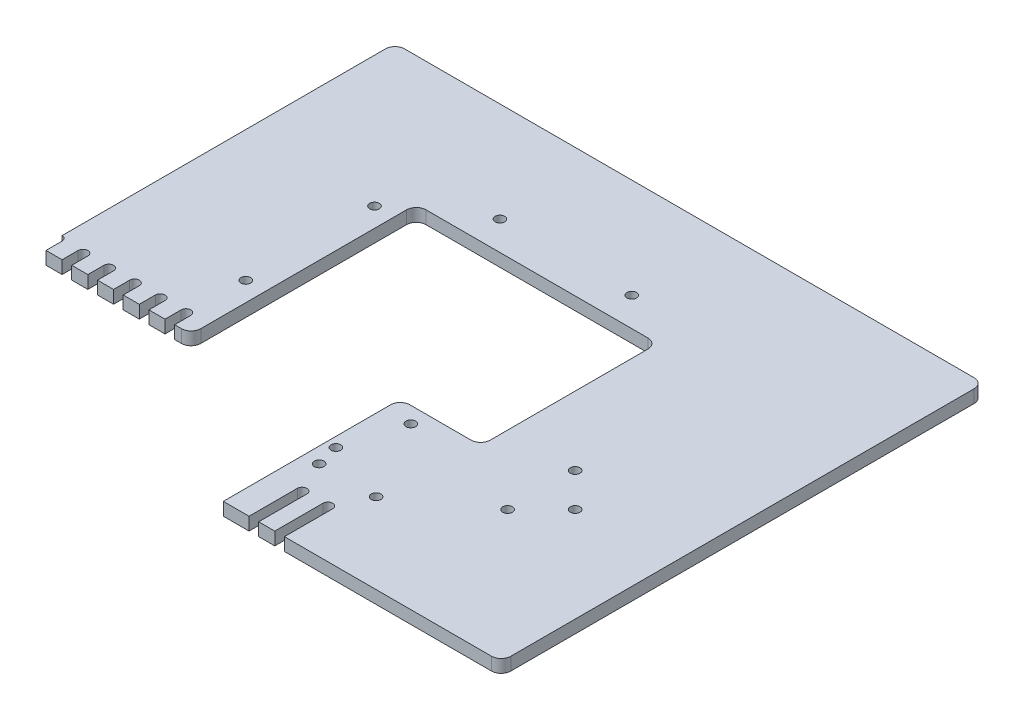
from build123d import *

# Parameters (mm, degrees)
SKETCH_1_R      = 1.5
EXTRUDE_3_DEPTH = 4
SKETCH_1_8_W    = 25
SKETCH_1_8_H    = 150
EXTRUDE_4_DEPTH = 4
FILLET_1_R      = 3


with BuildPart() as part:
    # 草图1 → 凸台-拉伸3 (new body)
    with BuildSketch(Plane(origin=(0, 0, 0), x_dir=(1, 0, 0), z_dir=(0, 1, 0))):
        with BuildLine():
            Line((97.132652086, -142.242252719), (105.132652086, -142.242252719))
            Line((105.132652086, -142.242252719), (105.132652086, -127.242252719))
            ThreePointArc((105.132652086, -127.242252719), (106.632652086, -125.742252719), (108.132652086, -127.242252719))
            Line((108.132652086, -127.242252719), (108.132652086, -142.242252719))
            Line((108.132652086, -142.242252719), (113.132652086, -142.242252719))
            Line((113.132652086, -142.242252719), (113.132652086, -127.242252719))
            ThreePointArc((113.132652086, -127.242252719), (114.632652086, -125.742252719), (116.132652086, -127.242252719))
            Line((116.132652086, -127.242252719), (116.132652086, -142.242252719))
            Line((116.132652086, -142.242252719), (158.517652086, -142.242252719))
            Line((158.517652086, -142.242252719), (158.517652086, 7.757747281))
            Line((158.517652086, 7.757747281), (0.517652086, 7.757747281))
            Line((0.517652086, 7.757747281), (0.517652086, -95.742252719))
            ThreePointArc((0.517652086, -95.742252719), (1.578312257, -96.181592547), (2.017652086, -97.242252719))
            Line((2.017652086, -97.242252719), (2.017652086, -102.242252719))
            Line((2.017652086, -102.242252719), (7.017652086, -102.242252719))
            Line((7.017652086, -102.242252719), (7.017652086, -97.242252719))
            ThreePointArc((7.017652086, -97.242252719), (8.517652086, -95.742252719), (10.017652086, -97.242252719))
            Line((10.017652086, -97.242252719), (10.017652086, -102.242252719))
            Line((10.017652086, -102.242252719), (15.017652086, -102.242252719))
            Line((15.017652086, -102.242252719), (15.017652086, -97.242252719))
            ThreePointArc((15.017652086, -97.242252719), (16.517652086, -95.742252719), (18.017652086, -97.242252719))
            Line((18.017652086, -97.242252719), (18.017652086, -102.242252719))
            Line((18.017652086, -102.242252719), (23.017652086, -102.242252719))
            Line((23.017652086, -102.242252719), (23.017652086, -97.242252719))
            ThreePointArc((23.017652086, -97.242252719), (24.517652086, -95.742252719), (26.017652086, -97.242252719))
            Line((26.017652086, -97.242252719), (26.017652086, -102.242252719))
            Line((26.017652086, -102.242252719), (31.017652086, -102.242252719))
            Line((31.017652086, -102.242252719), (31.017652086, -97.242252719))
            ThreePointArc((31.017652086, -97.242252719), (32.517652086, -95.742252719), (34.017652086, -97.242252719))
            Line((34.017652086, -97.242252719), (34.017652086, -102.242252719))
            Line((34.017652086, -102.242252719), (39.017652086, -102.242252719))
            Line((39.017652086, -102.242252719), (39.017652086, -97.242252719))
            ThreePointArc((39.017652086, -97.242252719), (40.517652086, -95.742252719), (42.017652086, -97.242252719))
            Line((42.017652086, -97.242252719), (42.017652086, -102.242252719))
            Line((42.017652086, -102.242252719), (47.132652086, -102.242252719))
            Line((47.132652086, -102.242252719), (47.132652086, -32.242252719))
            Line((47.132652086, -32.242252719), (122.132652086, -32.242252719))
            Line((122.132652086, -32.242252719), (122.132652086, -87.242252719))
            Line((122.132652086, -87.242252719), (97.132652086, -87.242252719))
            Line((97.132652086, -87.242252719), (97.132652086, -142.242252719))
        make_face()
        with Locations((101.932652086, -117.242252719)):
            Circle(SKETCH_1_R, mode=Mode.SUBTRACT)
        with Locations((119.632652086, -117.242252719)):
            Circle(SKETCH_1_R, mode=Mode.SUBTRACT)
        with Locations((105.422652086, -92.242252719)):
            Circle(SKETCH_1_R, mode=Mode.SUBTRACT)
        with Locations((100.132652086, -110.242252719)):
            Circle(SKETCH_1_R, mode=Mode.SUBTRACT)
        with Locations((105.132652086, -23.242252719)):
            Circle(SKETCH_1_R, mode=Mode.SUBTRACT)
        with Locations((41.132652086, -79.242252719)):
            Circle(SKETCH_1_R, mode=Mode.SUBTRACT)
        with Locations((143.517652086, -100.242252719)):
            Circle(SKETCH_1_R, mode=Mode.SUBTRACT)
        with Locations((154.017652086, -89.742252719)):
            Circle(SKETCH_1_R, mode=Mode.SUBTRACT)
        with Locations((143.517652086, -79.242252719)):
            Circle(SKETCH_1_R, mode=Mode.SUBTRACT)
        with Locations((41.132652086, -39.242252719)):
            Circle(SKETCH_1_R, mode=Mode.SUBTRACT)
        with Locations((64.132652086, -23.242252719)):
            Circle(SKETCH_1_R, mode=Mode.SUBTRACT)
    extrude(amount=EXTRUDE_3_DEPTH)

    # 草图1<8> → 凸台-拉伸4 (add)
    with BuildSketch(Plane(origin=(0, 0, 0), x_dir=(1, 0, 0), z_dir=(0, 1, 0))):
        with Locations((171.017652086, -67.242252719)):
            Rectangle(SKETCH_1_8_W, SKETCH_1_8_H)
    extrude(amount=EXTRUDE_4_DEPTH)

    # 圆角1
    fillet_1_edges = [part.edges().sort_by_distance(p)[0] for p in [
        (47.132652086, 2, 32.242252719),
        (122.132652086, 2, 32.242252719),
        (122.132652086, 2, 87.242252719),
        (97.132652086, 2, 87.242252719),
        (47.132652086, 2, 102.242252719),
        (183.517652086, 2, -7.757747281),
        (0.517652086, 2, -7.757747281),
        (183.517652086, 2, 142.242252719),
    ]]
    fillet(fillet_1_edges, radius=FILLET_1_R)


solid = part.part
